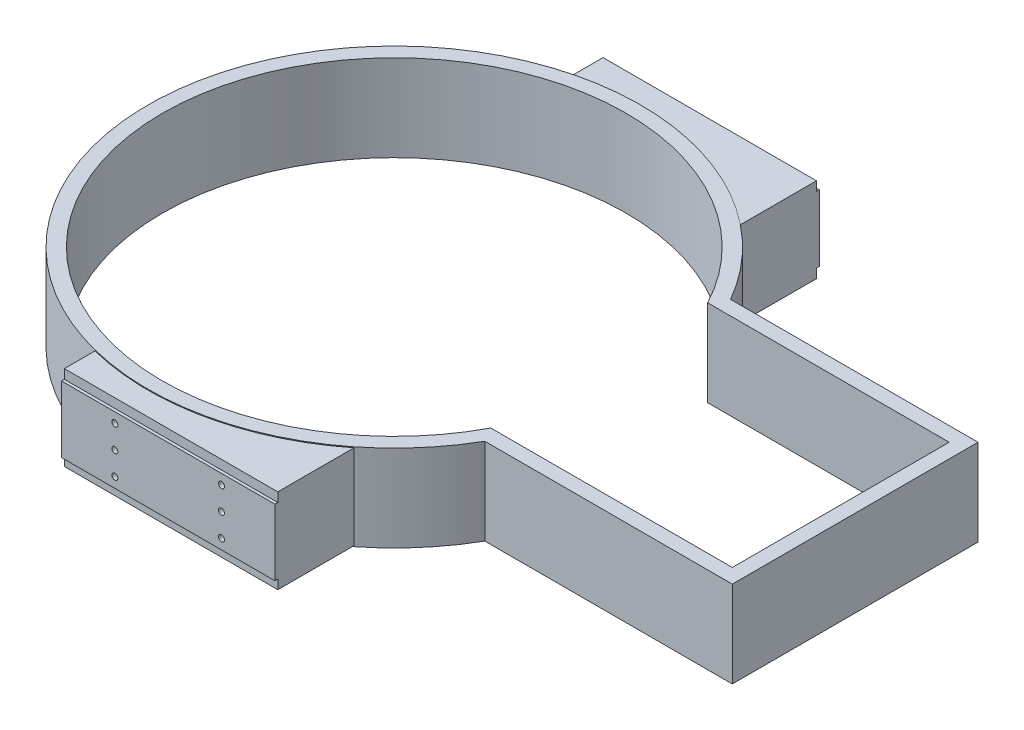
from build123d import *

# Parameters (mm, degrees)
BOSS_EXTRUDE1_DEPTH               = 150
BOSS_EXTRUDE2_START               = 1.5
BOSS_EXTRUDE2_DEPTH               = 147
BOSS_EXTRUDE2_2_DEPTH             = 16
BOSS_EXTRUDE2_START_2             = 132.5
BOSS_EXTRUDE2_3_DEPTH             = 16
BOSS_EXTRUDE3_START               = -15
SKETCH3_W                         = 370
SKETCH3_H                         = 115
BOSS_EXTRUDE3_DEPTH               = 20
TAP_DRILL_FOR_M12_TAP1_AT_2_COUNT = 2
TAP_DRILL_FOR_M12_TAP1_AT_2_PITCH = 80
TAP_DRILL_FOR_M12_TAP1_AT_3_COUNT = 2
TAP_DRILL_FOR_M12_TAP1_AT_3_PITCH = 185
TAP_DRILL_FOR_M12_TAP1_AT_4_COUNT = 2
TAP_DRILL_FOR_M12_TAP1_AT_4_PITCH = 201.556443707
TAP_DRILL_FOR_M12_TAP1_AT_5_COUNT = 2
TAP_DRILL_FOR_M12_TAP1_AT_5_PITCH = 189.274932307
TAP_DRILL_FOR_M12_TAP1_AT_6_COUNT = 2
TAP_DRILL_FOR_M12_TAP1_AT_6_PITCH = 40


# Read off the part's stored shape, not the designer's step: Boss-Extrude2
with BuildPart() as part:
    # Sketch1 → Boss-Extrude1 (new body)
    with BuildSketch(Plane(origin=(0, 0, 0), x_dir=(1, 0, 0), z_dir=(0, 1, 0))):
        with BuildLine():
            Line((799.081072199, 213), (370.081072199, 213))
            ThreePointArc((370.081072199, 213), (-427, 0), (370.081072199, -213))
            Line((370.081072199, -213), (799.081072199, -213))
            Line((799.081072199, -213), (799.081072199, 213))
        make_face()
        with BuildLine():
            Line((355.330831761, 188), (774.081072199, 188))
            Line((774.081072199, 188), (774.081072199, -188))
            Line((774.081072199, -188), (355.330831761, -188))
            ThreePointArc((355.330831761, -188), (-402, 0), (355.330831761, 188))
        make_face(mode=Mode.SUBTRACT)
    extrude(amount=BOSS_EXTRUDE1_DEPTH)

    # Boss-Extrude2 outline → Boss-Extrude2 (add)
    with BuildSketch(Plane(origin=(0, 0, 0), x_dir=(1, 0, 0), z_dir=(0, 1, 0)).offset(BOSS_EXTRUDE2_START)):
        with BuildLine():
            Line((249, -467), (265, -467))
            Line((265, -467), (265, -334.819354279))
            ThreePointArc((265, -334.819354279), (257.070777199, -340.945179626), (249, -346.883265667))
            Line((249, -346.883265667), (249, -467))
        make_face()
        with BuildLine():
            Line((-105, -467), (-89, -467))
            Line((-89, -467), (-89, -417.621838509))
            ThreePointArc((-89, -417.621838509), (-97.017955844, -415.83231746), (-105, -413.888873975))
            Line((-105, -413.888873975), (-105, -467))
        make_face()
    boss_extrude2 = extrude(amount=BOSS_EXTRUDE2_DEPTH)

    # Boss-Extrude2 2 outline → Boss-Extrude2 2 (add)
    with BuildSketch(Plane(origin=(0, 0, 0), x_dir=(1, 0, 0), z_dir=(0, 1, 0)).offset(BOSS_EXTRUDE2_START)):
        with BuildLine():
            Line((-89, -467), (249, -467))
            Line((249, -467), (249, -346.883265667))
            ThreePointArc((249, -346.883265667), (87.46991724, -417.944988698), (-89, -417.621838509))
            Line((-89, -417.621838509), (-89, -467))
        make_face()
    boss_extrude2_2 = extrude(amount=BOSS_EXTRUDE2_2_DEPTH)

    # Boss-Extrude2 3 outline → Boss-Extrude2 3 (add)
    with BuildSketch(Plane(origin=(0, 0, 0), x_dir=(1, 0, 0), z_dir=(0, 1, 0)).offset(BOSS_EXTRUDE2_START_2)):
        with BuildLine():
            Line((-89, -467), (249, -467))
            Line((249, -467), (249, -346.883265667))
            ThreePointArc((249, -346.883265667), (87.46991724, -417.944988698), (-89, -417.621838509))
            Line((-89, -417.621838509), (-89, -467))
        make_face()
    boss_extrude2_3 = extrude(amount=BOSS_EXTRUDE2_3_DEPTH)

    # Sketch3 → Boss-Extrude3 (add)
    with BuildSketch(Plane.XY.offset(467).offset(BOSS_EXTRUDE3_START)):
        with Locations((80, 75)):
            Rectangle(SKETCH3_W, SKETCH3_H)
    boss_extrude3 = extrude(amount=BOSS_EXTRUDE3_DEPTH)

    # Sketch7 → Tap Drill for M12 Tap1 (revolve, cut)
    with BuildSketch(Plane(origin=(172.5, 115, 472), x_dir=(0, -1, 0), z_dir=(1, 0, 0))):
        Polygon((0, 0), (0, 16), (5.2, 12.875524781), (5.2, 0), align=None)
    tap_drill_for_m12_tap1 = revolve(axis=Axis((172.5, 115, 478.35), (0, 0, -1)), mode=Mode.SUBTRACT)

    # Tap Drill for M12 Tap1 at 2: Tap Drill for M12 Tap1 ×2
    with Locations(*[(0, -i * TAP_DRILL_FOR_M12_TAP1_AT_2_PITCH, 0) for i in range(1, TAP_DRILL_FOR_M12_TAP1_AT_2_COUNT)]):
        add(tap_drill_for_m12_tap1, mode=Mode.SUBTRACT)

    # Tap Drill for M12 Tap1 at 3: Tap Drill for M12 Tap1 ×2
    with Locations(*[(-i * TAP_DRILL_FOR_M12_TAP1_AT_3_PITCH, 0, 0) for i in range(1, TAP_DRILL_FOR_M12_TAP1_AT_3_COUNT)]):
        add(tap_drill_for_m12_tap1, mode=Mode.SUBTRACT)

    # Tap Drill for M12 Tap1 at 4: Tap Drill for M12 Tap1 ×2
    with Locations(*[Vector(-0.9178570359601427, -0.3969111506854671, 0) * (i * TAP_DRILL_FOR_M12_TAP1_AT_4_PITCH) for i in range(1, TAP_DRILL_FOR_M12_TAP1_AT_4_COUNT)]):
        add(tap_drill_for_m12_tap1, mode=Mode.SUBTRACT)

    # Tap Drill for M12 Tap1 at 5: Tap Drill for M12 Tap1 ×2
    with Locations(*[Vector(-0.9774141654398674, -0.21133279252753864, 0) * (i * TAP_DRILL_FOR_M12_TAP1_AT_5_PITCH) for i in range(1, TAP_DRILL_FOR_M12_TAP1_AT_5_COUNT)]):
        add(tap_drill_for_m12_tap1, mode=Mode.SUBTRACT)

    # Tap Drill for M12 Tap1 at 6: Tap Drill for M12 Tap1 ×2
    with Locations(*[(0, -i * TAP_DRILL_FOR_M12_TAP1_AT_6_PITCH, 0) for i in range(1, TAP_DRILL_FOR_M12_TAP1_AT_6_COUNT)]):
        add(tap_drill_for_m12_tap1, mode=Mode.SUBTRACT)

    # Mirror1: Boss-Extrude2, Boss-Extrude2 2, Boss-Extrude2 3, Boss-Extrude3, Tap Drill for M12 Tap1 across plane
    add(boss_extrude2.mirror(Plane.XY))
    add(boss_extrude2_2.mirror(Plane.XY))
    add(boss_extrude2_3.mirror(Plane.XY))
    add(boss_extrude3.mirror(Plane.XY))
    add(tap_drill_for_m12_tap1.mirror(Plane.XY), mode=Mode.SUBTRACT)

    # Mirror1 copy 1 sketch → Mirror1 copy 1 (revolve, cut)
    with BuildSketch(Plane(origin=(172.5, 35, -472), x_dir=(0, -1, 0), z_dir=(1, 0, 0))):
        Polygon((0, 0), (0, -16), (5.2, -12.875524781), (5.2, 0), align=None)
    revolve(axis=Axis((172.5, 35, -478.35), (0, 0, -1)), mode=Mode.SUBTRACT)

    # Mirror1 copy 2 sketch → Mirror1 copy 2 (revolve, cut)
    with BuildSketch(Plane(origin=(-12.5, 115, -472), x_dir=(0, -1, 0), z_dir=(1, 0, 0))):
        Polygon((0, 0), (0, -16), (5.2, -12.875524781), (5.2, 0), align=None)
    revolve(axis=Axis((-12.5, 115, -478.35), (0, 0, -1)), mode=Mode.SUBTRACT)

    # Mirror1 copy 3 sketch → Mirror1 copy 3 (revolve, cut)
    with BuildSketch(Plane(origin=(-12.5, 35, -472), x_dir=(0, -1, 0), z_dir=(1, 0, 0))):
        Polygon((0, 0), (0, -16), (5.2, -12.875524781), (5.2, 0), align=None)
    revolve(axis=Axis((-12.5, 35, -478.35), (0, 0, -1)), mode=Mode.SUBTRACT)

    # Mirror1 copy 4 sketch → Mirror1 copy 4 (revolve, cut)
    with BuildSketch(Plane(origin=(-12.5, 75, -472), x_dir=(0, -1, 0), z_dir=(1, 0, 0))):
        Polygon((0, 0), (0, -16), (5.2, -12.875524781), (5.2, 0), align=None)
    revolve(axis=Axis((-12.5, 75, -478.35), (0, 0, -1)), mode=Mode.SUBTRACT)

    # Mirror1 copy 5 sketch → Mirror1 copy 5 (revolve, cut)
    with BuildSketch(Plane(origin=(172.5, 75, -472), x_dir=(0, -1, 0), z_dir=(1, 0, 0))):
        Polygon((0, 0), (0, -16), (5.2, -12.875524781), (5.2, 0), align=None)
    revolve(axis=Axis((172.5, 75, -478.35), (0, 0, -1)), mode=Mode.SUBTRACT)


solid = part.part
